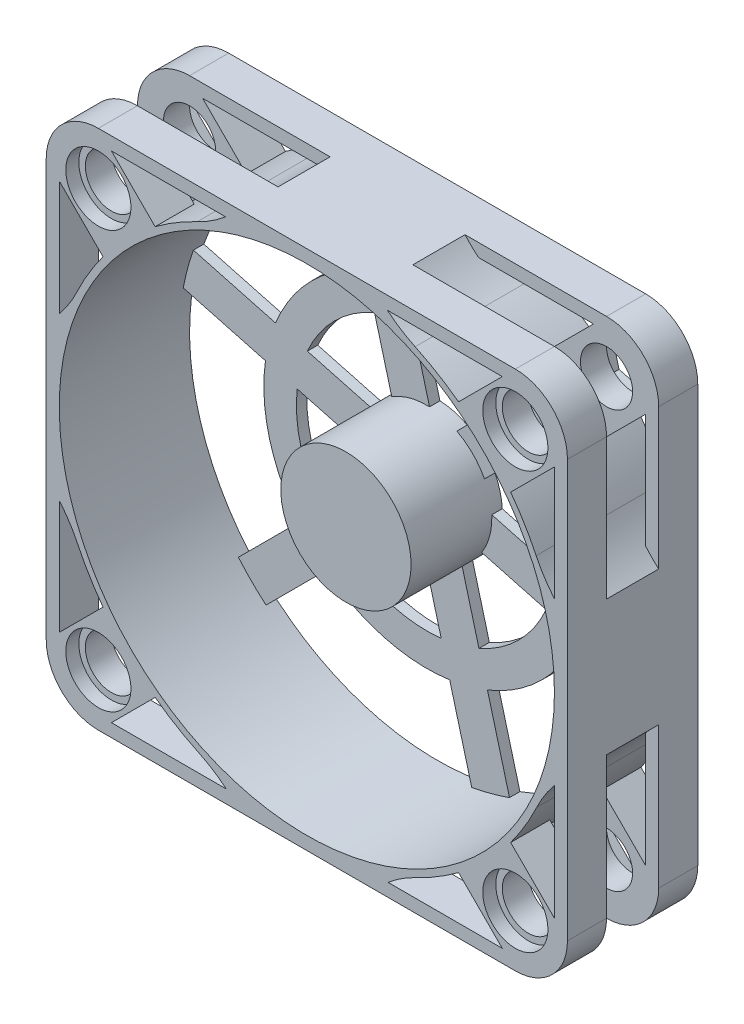
from build123d import *
from build123d.topology import SkipClean

# Parameters (mm, degrees)
ESQUISSE1_R                        = 2
ESQUISSE1_R_2                      = 19
ESQUISSE1_R_3                      = 5
BOSS_EXTRU_1_DEPTH                 = 10
ENL_V_START                        = -9.2
ESQUISSE2_R                        = 19
ESQUISSE2_R_2                      = 5
ENL_V_MAT_EXTRU_1_DEPTH            = 9.2
ENL_V_MAT_EXTRU_2_DEPTH            = 3
ESQUISSE4_R                        = 2.5
ENL_V_MAT_EXTRU_3_DEPTH            = 1
R_P_TITION_CIRCULAIRE1_COUNT       = 4
ENL_V_START_2                      = -3
ESQUISSE5_R                        = 5
ENL_V_MAT_EXTRU_4_DEPTH            = 3
SYM_TRIE1_COPY_1_DEPTH             = 3
SYM_TRIE1_COPY_2_DEPTH             = 3
SYM_TRIE1_COPY_3_DEPTH             = 3
SYM_TRIE1_COPY_4_SKETCH_R          = 2.5
SYM_TRIE1_COPY_4_DEPTH             = 1
SYM_TRIE1_COPY_5_SKETCH_R          = 2.5
SYM_TRIE1_COPY_5_DEPTH             = 1
SYM_TRIE1_COPY_6_SKETCH_R          = 2.5
SYM_TRIE1_COPY_6_DEPTH             = 1
ENL_V_MAT_EXTRU_5_REACH            = 57.815
ENL_V_MAT_EXTRU_5_END_RADIUS       = 19.5
ESQUISSE6_W                        = 20.966681846
ESQUISSE6_H                        = 4
CONG_2_R                           = 10
ENL_V_MAT_EXTRU_6_DEPTH            = 1
R_P_TITION_CIRCULAIRE3_COUNT       = 4
CONG_2_OF_R_P_TITION_CIRCULAIRE3_R = 10


with BuildPart() as part:
    # Esquisse1 → Boss.-Extru.1 (new body)
    # profile 1 of 26: a face of its own
    with BuildSketch(Plane.XY):
        with BuildLine():
            Line((16, 20), (-16, 20))
            ThreePointArc((-16, 20), (-18.828427125, 18.828427125), (-20, 16))
            Line((-20, 16), (-20, -16))
            ThreePointArc((-20, -16), (-18.828427125, -18.828427125), (-16, -20))
            Line((-16, -20), (16, -20))
            ThreePointArc((16, -20), (18.828427125, -18.828427125), (20, -16))
            Line((20, -16), (20, 16))
            ThreePointArc((20, 16), (18.828427125, 18.828427125), (16, 20))
        make_face()
        with Locations((-16, -16)):
            Circle(ESQUISSE1_R, mode=Mode.SUBTRACT)
        with Locations((16, -16)):
            Circle(ESQUISSE1_R, mode=Mode.SUBTRACT)
        with Locations((16, 16)):
            Circle(ESQUISSE1_R, mode=Mode.SUBTRACT)
        with Locations((-16, 16)):
            Circle(ESQUISSE1_R, mode=Mode.SUBTRACT)
        Circle(ESQUISSE1_R_2, mode=Mode.SUBTRACT)
    # profile 2 of 26: a face of its own
    with BuildSketch(Plane.XY):
        with BuildLine():
            Line((-12.332435064, -14.453755408), (-7.714304216, -9.835624559))
            ThreePointArc((-7.714304216, -9.835624559), (-8.838834765, -8.838834765), (-9.835624559, -7.714304216))
            Line((-9.835624559, -7.714304216), (-14.453755408, -12.332435064))
            ThreePointArc((-14.453755408, -12.332435064), (-13.435028843, -13.435028843), (-12.332435064, -14.453755408))
        make_face()
    # profile 3 of 26: a face of its own
    with BuildSketch(Plane.XY):
        with BuildLine():
            ThreePointArc((-8.051725899, -5.930405555), (-9.659258263, -2.588190451), (-9.93820195, 1.110018916))
            Line((-9.93820195, 1.110018916), (-12.375052838, 1.762971144))
            ThreePointArc((-12.375052838, 1.762971144), (-12.074072829, -3.235238064), (-9.835624559, -7.714304216))
            Line((-9.835624559, -7.714304216), (-8.051725899, -5.930405555))
        make_face()
    # profile 4 of 26: a face of its own
    with BuildSketch(Plane.XY):
        with BuildLine():
            Line((-7.714304216, -9.835624559), (-5.930405555, -8.051725899))
            ThreePointArc((-5.930405555, -8.051725899), (-7.071067812, -7.071067812), (-8.051725899, -5.930405555))
            Line((-8.051725899, -5.930405555), (-9.835624559, -7.714304216))
            ThreePointArc((-9.835624559, -7.714304216), (-8.838834765, -8.838834765), (-7.714304216, -9.835624559))
        make_face()
    # profile 5 of 26: a face of its own
    with BuildSketch(Plane.XY):
        with BuildLine():
            ThreePointArc((-8.051725899, -5.930405555), (-7.071067812, -7.071067812), (-5.930405555, -8.051725899))
            Line((-5.930405555, -8.051725899), (-2.312024219, -4.433344563))
            ThreePointArc((-2.312024219, -4.433344563), (-3.535533906, -3.535533906), (-4.433344563, -2.312024219))
            Line((-4.433344563, -2.312024219), (-8.051725899, -5.930405555))
        make_face()
    # profile 6 of 26: a face of its own
    with BuildSketch(Plane.XY):
        with BuildLine():
            Line((1.762971144, -12.375052838), (1.110018916, -9.93820195))
            ThreePointArc((1.110018916, -9.93820195), (-2.588190451, -9.659258263), (-5.930405555, -8.051725899))
            Line((-5.930405555, -8.051725899), (-7.714304216, -9.835624559))
            ThreePointArc((-7.714304216, -9.835624559), (-3.235238064, -12.074072829), (1.762971144, -12.375052838))
        make_face()
    # profile 7 of 26: a face of its own
    with BuildSketch(Plane.XY):
        with BuildLine():
            Line((4.660748623, -11.598595703), (4.007796395, -9.161744815))
            ThreePointArc((4.007796395, -9.161744815), (2.588190451, -9.659258263), (1.110018916, -9.93820195))
            Line((1.110018916, -9.93820195), (1.762971144, -12.375052838))
            ThreePointArc((1.762971144, -12.375052838), (3.235238064, -12.074072829), (4.660748623, -11.598595703))
        make_face()
    # profile 8 of 26: a face of its own
    with BuildSketch(Plane.XY):
        with BuildLine():
            ThreePointArc((1.110018916, -9.93820195), (2.588190451, -9.659258263), (4.007796395, -9.161744815))
            Line((4.007796395, -9.161744815), (2.683376905, -4.218943989))
            ThreePointArc((2.683376905, -4.218943989), (1.294095226, -4.829629131), (-0.214400573, -4.995401124))
            Line((-0.214400573, -4.995401124), (1.110018916, -9.93820195))
        make_face()
    # profile 9 of 26: a face of its own
    with BuildSketch(Plane.XY):
        with BuildLine():
            Line((6.351101831, -17.90707976), (4.660748623, -11.598595703))
            ThreePointArc((4.660748623, -11.598595703), (3.235238064, -12.074072829), (1.762971144, -12.375052838))
            Line((1.762971144, -12.375052838), (3.453324352, -18.683536895))
            ThreePointArc((3.453324352, -18.683536895), (4.917561857, -18.352590699), (6.351101831, -17.90707976))
        make_face()
    # profile 10 of 26: a face of its own
    with BuildSketch(Plane.XY):
        Circle(ESQUISSE1_R_3)
    # profile 11 of 26: a face of its own
    with BuildSketch(Plane.XY):
        with BuildLine():
            ThreePointArc((-12.375052838, 1.762971144), (-12.074072829, 3.235238064), (-11.598595703, 4.660748623))
            Line((-11.598595703, 4.660748623), (-17.90707976, 6.351101831))
            ThreePointArc((-17.90707976, 6.351101831), (-18.352590699, 4.917561857), (-18.683536895, 3.453324352))
            Line((-18.683536895, 3.453324352), (-12.375052838, 1.762971144))
        make_face()
    # profile 12 of 26: a face of its own
    with BuildSketch(Plane.XY):
        with BuildLine():
            ThreePointArc((-9.93820195, 1.110018916), (-9.659258263, 2.588190451), (-9.161744815, 4.007796395))
            Line((-9.161744815, 4.007796395), (-11.598595703, 4.660748623))
            ThreePointArc((-11.598595703, 4.660748623), (-12.074072829, 3.235238064), (-12.375052838, 1.762971144))
            Line((-12.375052838, 1.762971144), (-9.93820195, 1.110018916))
        make_face()
    # profile 13 of 26: a face of its own
    with BuildSketch(Plane.XY):
        with BuildLine():
            ThreePointArc((-4.995401124, -0.214400573), (-4.829629131, 1.294095226), (-4.218943989, 2.683376905))
            Line((-4.218943989, 2.683376905), (-9.161744815, 4.007796395))
            ThreePointArc((-9.161744815, 4.007796395), (-9.659258263, 2.588190451), (-9.93820195, 1.110018916))
            Line((-9.93820195, 1.110018916), (-4.995401124, -0.214400573))
        make_face()
    # profile 14 of 26: a face of its own
    with BuildSketch(Plane.XY):
        with BuildLine():
            ThreePointArc((-9.161744815, 4.007796395), (-7.071067812, 7.071067812), (-4.007796395, 9.161744815))
            Line((-4.007796395, 9.161744815), (-4.660748623, 11.598595703))
            ThreePointArc((-4.660748623, 11.598595703), (-8.838834765, 8.838834765), (-11.598595703, 4.660748623))
            Line((-11.598595703, 4.660748623), (-9.161744815, 4.007796395))
        make_face()
    # profile 15 of 26: a face of its own
    with BuildSketch(Plane.XY):
        with BuildLine():
            ThreePointArc((-4.660748623, 11.598595703), (-3.235238064, 12.074072829), (-1.762971144, 12.375052838))
            Line((-1.762971144, 12.375052838), (-3.453324352, 18.683536895))
            ThreePointArc((-3.453324352, 18.683536895), (-4.917561857, 18.352590699), (-6.351101831, 17.90707976))
            Line((-6.351101831, 17.90707976), (-4.660748623, 11.598595703))
        make_face()
    # profile 16 of 26: a face of its own
    with BuildSketch(Plane.XY):
        with BuildLine():
            ThreePointArc((-4.007796395, 9.161744815), (-2.588190451, 9.659258263), (-1.110018916, 9.93820195))
            Line((-1.110018916, 9.93820195), (-1.762971144, 12.375052838))
            ThreePointArc((-1.762971144, 12.375052838), (-3.235238064, 12.074072829), (-4.660748623, 11.598595703))
            Line((-4.660748623, 11.598595703), (-4.007796395, 9.161744815))
        make_face()
    # profile 17 of 26: a face of its own
    with BuildSketch(Plane.XY):
        with BuildLine():
            ThreePointArc((-2.683376905, 4.218943989), (-1.294095226, 4.829629131), (0.214400573, 4.995401124))
            Line((0.214400573, 4.995401124), (-1.110018916, 9.93820195))
            ThreePointArc((-1.110018916, 9.93820195), (-2.588190451, 9.659258263), (-4.007796395, 9.161744815))
            Line((-4.007796395, 9.161744815), (-2.683376905, 4.218943989))
        make_face()
    # profile 18 of 26: a face of its own
    with BuildSketch(Plane.XY):
        with BuildLine():
            ThreePointArc((-1.110018916, 9.93820195), (2.588190451, 9.659258263), (5.930405555, 8.051725899))
            Line((5.930405555, 8.051725899), (7.714304216, 9.835624559))
            ThreePointArc((7.714304216, 9.835624559), (3.235238064, 12.074072829), (-1.762971144, 12.375052838))
            Line((-1.762971144, 12.375052838), (-1.110018916, 9.93820195))
        make_face()
    # profile 19 of 26: a face of its own
    with BuildSketch(Plane.XY):
        with BuildLine():
            ThreePointArc((7.714304216, 9.835624559), (8.838834765, 8.838834765), (9.835624559, 7.714304216))
            Line((9.835624559, 7.714304216), (14.453755408, 12.332435064))
            ThreePointArc((14.453755408, 12.332435064), (13.435028843, 13.435028843), (12.332435064, 14.453755408))
            Line((12.332435064, 14.453755408), (7.714304216, 9.835624559))
        make_face()
    # profile 20 of 26: a face of its own
    with BuildSketch(Plane.XY):
        with BuildLine():
            ThreePointArc((2.312024219, 4.433344563), (3.535533906, 3.535533906), (4.433344563, 2.312024219))
            Line((4.433344563, 2.312024219), (8.051725899, 5.930405555))
            ThreePointArc((8.051725899, 5.930405555), (7.071067812, 7.071067812), (5.930405555, 8.051725899))
            Line((5.930405555, 8.051725899), (2.312024219, 4.433344563))
        make_face()
    # profile 21 of 26: a face of its own
    with BuildSketch(Plane.XY):
        with BuildLine():
            ThreePointArc((5.930405555, 8.051725899), (7.071067812, 7.071067812), (8.051725899, 5.930405555))
            Line((8.051725899, 5.930405555), (9.835624559, 7.714304216))
            ThreePointArc((9.835624559, 7.714304216), (8.838834765, 8.838834765), (7.714304216, 9.835624559))
            Line((7.714304216, 9.835624559), (5.930405555, 8.051725899))
        make_face()
    # profile 22 of 26: a face of its own
    with BuildSketch(Plane.XY):
        with BuildLine():
            Line((9.835624559, 7.714304216), (8.051725899, 5.930405555))
            ThreePointArc((8.051725899, 5.930405555), (9.500454173, 3.121116868), (10, 0))
            ThreePointArc((10, 0), (9.984538535, -0.555868913), (9.93820195, -1.110018916))
            Line((9.93820195, -1.110018916), (12.375052838, -1.762971144))
            ThreePointArc((12.375052838, -1.762971144), (12.468724082, -0.883696646), (12.5, 0))
            ThreePointArc((12.5, 0), (11.81514509, 4.080728673), (9.835624559, 7.714304216))
        make_face()
    # profile 23 of 26: a face of its own
    with BuildSketch(Plane.XY):
        with BuildLine():
            Line((12.375052838, -1.762971144), (9.93820195, -1.110018916))
            ThreePointArc((9.93820195, -1.110018916), (9.659258263, -2.588190451), (9.161744815, -4.007796395))
            Line((9.161744815, -4.007796395), (11.598595703, -4.660748623))
            ThreePointArc((11.598595703, -4.660748623), (12.074072829, -3.235238064), (12.375052838, -1.762971144))
        make_face()
    # profile 24 of 26: a face of its own
    with BuildSketch(Plane.XY):
        with BuildLine():
            Line((18.683536895, -3.453324352), (12.375052838, -1.762971144))
            ThreePointArc((12.375052838, -1.762971144), (12.074072829, -3.235238064), (11.598595703, -4.660748623))
            Line((11.598595703, -4.660748623), (17.90707976, -6.351101831))
            ThreePointArc((17.90707976, -6.351101831), (18.352590699, -4.917561857), (18.683536895, -3.453324352))
        make_face()
    # profile 25 of 26: a face of its own
    with BuildSketch(Plane.XY):
        with BuildLine():
            Line((11.598595703, -4.660748623), (9.161744815, -4.007796395))
            ThreePointArc((9.161744815, -4.007796395), (7.071067812, -7.071067812), (4.007796395, -9.161744815))
            Line((4.007796395, -9.161744815), (4.660748623, -11.598595703))
            ThreePointArc((4.660748623, -11.598595703), (8.838834765, -8.838834765), (11.598595703, -4.660748623))
        make_face()
    # profile 26 of 26: a face of its own
    with BuildSketch(Plane.XY):
        with BuildLine():
            Line((9.93820195, -1.110018916), (4.995401124, 0.214400573))
            ThreePointArc((4.995401124, 0.214400573), (4.998850149, 0.107224945), (5, 0))
            ThreePointArc((5, 0), (4.800766603, -1.397368966), (4.218943989, -2.683376905))
            Line((4.218943989, -2.683376905), (9.161744815, -4.007796395))
            ThreePointArc((9.161744815, -4.007796395), (9.659258263, -2.588190451), (9.93820195, -1.110018916))
        make_face()
    extrude(amount=BOSS_EXTRU_1_DEPTH)

    # Esquisse2 → Enlèv. mat.-Extru.1 (cut)
    with BuildSketch(Plane.XY.offset(10).offset(ENL_V_START)):
        with Locations(Location((0, 0, 0), (0, 0, 169.528063014))):
            Circle(ESQUISSE2_R)
        with Locations(Location((0, 0, 0), (0, 0, 182.457603124))):
            Circle(ESQUISSE2_R_2, mode=Mode.SUBTRACT)
    extrude(amount=ENL_V_MAT_EXTRU_1_DEPTH, mode=Mode.SUBTRACT)

    # Esquisse3 → Enlèv. mat.-Extru.2 (cut)
    with BuildSketch(Plane.XY.offset(10)):
        with BuildLine():
            Line((19, 4.387482194), (19, 15))
            Line((19, 15), (15.64276365, 11.64276365))
            ThreePointArc((15.64276365, 11.64276365), (17.697176203, 8.189014252), (19, 4.387482194))
        make_face()
        with BuildLine():
            Line((11.64276365, 15.64276365), (15, 19))
            Line((15, 19), (4.387482194, 19))
            ThreePointArc((4.387482194, 19), (8.189014252, 17.697176203), (11.64276365, 15.64276365))
        make_face()
    enl_v_mat_extru_2 = extrude(amount=-ENL_V_MAT_EXTRU_2_DEPTH, mode=Mode.SUBTRACT)

    # Esquisse4 → Enlèv. mat.-Extru.3 (cut)
    with BuildSketch(Plane.XY.offset(10)):
        with Locations((16, 16)):
            Circle(ESQUISSE4_R)
    enl_v_mat_extru_3 = extrude(amount=-ENL_V_MAT_EXTRU_3_DEPTH, mode=Mode.SUBTRACT)

    # Répétition circulaire1: Enlèv. mat.-Extru.2, Enlèv. mat.-Extru.3 ×4 about axis
    r_p_tition_circulaire1_axis = Axis((0, 0, 0), (0, 0, 1))
    add([enl_v_mat_extru_2.rotate(r_p_tition_circulaire1_axis, i * 360 / R_P_TITION_CIRCULAIRE1_COUNT) for i in range(1, R_P_TITION_CIRCULAIRE1_COUNT)], mode=Mode.SUBTRACT)
    add([enl_v_mat_extru_3.rotate(r_p_tition_circulaire1_axis, i * 360 / R_P_TITION_CIRCULAIRE1_COUNT) for i in range(1, R_P_TITION_CIRCULAIRE1_COUNT)], mode=Mode.SUBTRACT)

    # Esquisse5 → Enlèv. mat.-Extru.4 (cut)
    with BuildSketch(Plane.XY.offset(10).offset(ENL_V_START_2)):
        with Locations(Location((0, 0, 0), (0, 0, 182.457603124))):
            Circle(ESQUISSE5_R)
    extrude(amount=ENL_V_MAT_EXTRU_4_DEPTH, mode=Mode.SUBTRACT)

    # Symétrie1: Enlèv. mat.-Extru.2, Enlèv. mat.-Extru.3 across plane
    add(enl_v_mat_extru_2.mirror(Plane.XY.offset(5)), mode=Mode.SUBTRACT)
    add(enl_v_mat_extru_3.mirror(Plane.XY.offset(5)), mode=Mode.SUBTRACT)

    # Symétrie1 copy 1 sketch → Symétrie1 copy 1 (cut)
    with BuildSketch(Plane.YX):
        with BuildLine():
            Line((19, -4.387482194), (19, -15))
            Line((19, -15), (15.64276365, -11.64276365))
            ThreePointArc((15.64276365, -11.64276365), (17.697176203, -8.189014252), (19, -4.387482194))
        make_face()
        with BuildLine():
            Line((11.64276365, -15.64276365), (15, -19))
            Line((15, -19), (4.387482194, -19))
            ThreePointArc((4.387482194, -19), (8.189014252, -17.697176203), (11.64276365, -15.64276365))
        make_face()
    extrude(amount=-SYM_TRIE1_COPY_1_DEPTH, mode=Mode.SUBTRACT)

    # Symétrie1 copy 2 sketch → Symétrie1 copy 2 (cut)
    with BuildSketch(Plane(origin=(0, 0, 0), x_dir=(-1, 0, 0), z_dir=(0, 0, -1))):
        with BuildLine():
            Line((19, -4.387482194), (19, -15))
            Line((19, -15), (15.64276365, -11.64276365))
            ThreePointArc((15.64276365, -11.64276365), (17.697176203, -8.189014252), (19, -4.387482194))
        make_face()
        with BuildLine():
            Line((11.64276365, -15.64276365), (15, -19))
            Line((15, -19), (4.387482194, -19))
            ThreePointArc((4.387482194, -19), (8.189014252, -17.697176203), (11.64276365, -15.64276365))
        make_face()
    extrude(amount=-SYM_TRIE1_COPY_2_DEPTH, mode=Mode.SUBTRACT)

    # Symétrie1 copy 3 sketch → Symétrie1 copy 3 (cut)
    with BuildSketch(Plane(origin=(0, 0, 0), x_dir=(0, -1, 0), z_dir=(0, 0, -1))):
        with BuildLine():
            Line((19, -4.387482194), (19, -15))
            Line((19, -15), (15.64276365, -11.64276365))
            ThreePointArc((15.64276365, -11.64276365), (17.697176203, -8.189014252), (19, -4.387482194))
        make_face()
        with BuildLine():
            Line((11.64276365, -15.64276365), (15, -19))
            Line((15, -19), (4.387482194, -19))
            ThreePointArc((4.387482194, -19), (8.189014252, -17.697176203), (11.64276365, -15.64276365))
        make_face()
    extrude(amount=-SYM_TRIE1_COPY_3_DEPTH, mode=Mode.SUBTRACT)

    # Symétrie1 copy 4 sketch → Symétrie1 copy 4 (cut)
    with BuildSketch(Plane.YX):
        with Locations((16, -16)):
            Circle(SYM_TRIE1_COPY_4_SKETCH_R)
    extrude(amount=-SYM_TRIE1_COPY_4_DEPTH, mode=Mode.SUBTRACT)

    # Symétrie1 copy 5 sketch → Symétrie1 copy 5 (cut)
    with BuildSketch(Plane(origin=(0, 0, 0), x_dir=(-1, 0, 0), z_dir=(0, 0, -1))):
        with Locations((16, -16)):
            Circle(SYM_TRIE1_COPY_5_SKETCH_R)
    extrude(amount=-SYM_TRIE1_COPY_5_DEPTH, mode=Mode.SUBTRACT)

    # Symétrie1 copy 6 sketch → Symétrie1 copy 6 (cut)
    with BuildSketch(Plane(origin=(0, 0, 0), x_dir=(0, -1, 0), z_dir=(0, 0, -1))):
        with Locations((16, -16)):
            Circle(SYM_TRIE1_COPY_6_SKETCH_R)
    extrude(amount=-SYM_TRIE1_COPY_6_DEPTH, mode=Mode.SUBTRACT)

    # Enlèv. mat.-Extru.5: up to this cylinder (the profile starts outside it)
    with SkipClean():  # the faces are left unmerged after this step: merging them gives an invalid solid
        enl_v_mat_extru_5_end = Plane(origin=(0, 0, 5), z_dir=(0, 0, 1)) * Cylinder(ENL_V_MAT_EXTRU_5_END_RADIUS, 155.63, mode=Mode.PRIVATE)
        # Esquisse6 → Enlèv. mat.-Extru.5 (cut, up to the surface)
        with BuildSketch(Plane(origin=(18.828427125, 18.828427125, 0), x_dir=(0.7071067811865465, -0.7071067811865487, 0), z_dir=(0.7071067811865487, 0.7071067811865465, 0)), mode=Mode.PRIVATE) as enl_v_mat_extru_5_sk1:
            with Locations((-0.026783461, -5)):
                Rectangle(ESQUISSE6_W, ESQUISSE6_H)
        enl_v_mat_extru_5_tool1 = extrude(enl_v_mat_extru_5_sk1.sketch, amount=-ENL_V_MAT_EXTRU_5_REACH, mode=Mode.PRIVATE) - enl_v_mat_extru_5_end
        enl_v_mat_extru_5 = enl_v_mat_extru_5_tool1.solids().sort_by_distance((18.809488, 18.847366, 5))[0]
        add(enl_v_mat_extru_5, mode=Mode.SUBTRACT)

    # Congé2
    # the kernel refuses this fillet: 10 mm, written as the material it adds along each edge
    with BuildSketch(Plane(origin=(4.182592024, 19.046152471, -7.900502874), x_dir=(0.7071067811865485, 0.7071067811865466, 0), z_dir=(0, 0, 1))) as cong_2_piece_1_section:
        with BuildLine():
            CenterArc((11.33494574, -0.528934288), CONG_2_R, 176.968014873, 22.808085693)
            Line((1.924725912, -3.912388558), (1.736521516, -3.980057643))
            ThreePointArc((1.736521516, -3.980057643), (0.892599014, -1.99051512), (-0.168463618, -0.107796148))
            Line((-0.168463618, -0.107796148), (0, 0.2))
            ThreePointArc((0, 0.2), (0.674472056, 0.2), (1.149224079, 0.010578686))
            Line((1.149224079, 0.010578686), (1.348944112, 0))
        make_face()
    cong_2_piece_1 = extrude(amount=25.801005748, mode=Mode.PRIVATE)
    cong_2_piece_1 = split(cong_2_piece_1, bisect_by=Plane(origin=(5.678335463, 18.852677109, 0), z_dir=(0, 0, 1)), keep=Keep.TOP, mode=Mode.PRIVATE)
    cong_2_piece_1 = split(cong_2_piece_1, bisect_by=Plane(origin=(5.678335463, 18.852677109, 10), z_dir=(0, 0, -1)), keep=Keep.TOP, mode=Mode.PRIVATE)
    add(cong_2_piece_1)
    with BuildSketch(Plane(origin=(19.032425062, 4.244619683, -7.981208952), x_dir=(0.7071067811865501, 0.7071067811865449, 0), z_dir=(0, 0, 1))) as cong_2_piece_2_section:
        with BuildLine():
            CenterArc((11.349602028, 0.612176168), CONG_2_R, 160.506018461, 23.003687105)
            Line((1.922836532, 3.949254573), (1.734301222, 4.015996141))
            ThreePointArc((1.734301222, 4.015996141), (0.893153357, 2.007864511), (-0.16881391, 0.107246743))
            Line((-0.16881391, 0.107246743), (0, -0.2))
            ThreePointArc((0, -0.2), (0.6841788, -0.2), (1.168732711, -0.012243523))
            Line((1.168732711, -0.012243523), (1.3683576, 0))
        make_face()
    cong_2_piece_2 = extrude(amount=25.962417905, mode=Mode.PRIVATE)
    cong_2_piece_2 = split(cong_2_piece_2, bisect_by=Plane(origin=(18.836675219, 5.749474293, 0), z_dir=(0, 0, 1)), keep=Keep.TOP, mode=Mode.PRIVATE)
    cong_2_piece_2 = split(cong_2_piece_2, bisect_by=Plane(origin=(18.836675219, 5.749474293, 10), z_dir=(0, 0, -1)), keep=Keep.TOP, mode=Mode.PRIVATE)
    add(cong_2_piece_2)

    # Esquisse7 → Enlèv. mat.-Extru.6 (cut)
    with BuildSketch(Plane(origin=(0, 0, 0), x_dir=(-1, 0, 0), z_dir=(0, 0, -1))):
        Polygon((18.041241452, 18.041241452), (15.252853773, 18.788387679), (13.211612321, 16.747146227), (13.958758548, 13.958758548), (16.747146227, 13.211612321), (18.788387679, 15.252853773), align=None)
    enl_v_mat_extru_6 = extrude(amount=-ENL_V_MAT_EXTRU_6_DEPTH, mode=Mode.SUBTRACT)

    # Répétition circulaire3: Enlèv. mat.-Extru.5, Enlèv. mat.-Extru.6 ×4 about axis
    r_p_tition_circulaire3_axis = Axis((0, 0, 0), (0, 0, 1))
    add([enl_v_mat_extru_5.rotate(r_p_tition_circulaire3_axis, i * 360 / R_P_TITION_CIRCULAIRE3_COUNT) for i in range(1, R_P_TITION_CIRCULAIRE3_COUNT)], mode=Mode.SUBTRACT)
    add([enl_v_mat_extru_6.rotate(r_p_tition_circulaire3_axis, i * 360 / R_P_TITION_CIRCULAIRE3_COUNT) for i in range(1, R_P_TITION_CIRCULAIRE3_COUNT)], mode=Mode.SUBTRACT)

    # Congé2 of Répétition circulaire3
    # the kernel refuses this fillet: 10 mm, written as the material it adds along each edge
    with BuildSketch(Plane(origin=(-19.046152471, 4.182592024, -7.900502874), x_dir=(0.3223451595781344, 0.946622204523297, 0), z_dir=(0, 0, 1))) as cong_2_of_r_p_tition_circulaire3_piece_1_section:
        with BuildLine():
            CenterArc((5.478201444, 9.937307248), CONG_2_OF_R_P_TITION_CIRCULAIRE3_R, 240.772824507, 22.808085693)
            Line((0.595465117, 1.210401384), (0.49781039, 1.035863267))
            ThreePointArc((0.49781039, 1.035863267), (0.118273473, 0.693486799), (-0.179459086, 0.088286106))
            Line((-0.179459086, 0.088286106), (0.022360006, -0.198746145))
            ThreePointArc((0.022360006, -0.198746145), (2.180100575, -0.077749134), (4.337841144, -0.198746145))
            Line((4.337841144, -0.198746145), (4.36020115, 0))
        make_face()
    cong_2_of_r_p_tition_circulaire3_piece_1 = extrude(amount=25.801005748, mode=Mode.PRIVATE)
    cong_2_of_r_p_tition_circulaire3_piece_1 = split(cong_2_of_r_p_tition_circulaire3_piece_1, bisect_by=Plane(origin=(-18.852677109, 5.678335463, 10), z_dir=(0, 0, -1)), keep=Keep.TOP, mode=Mode.PRIVATE)
    cong_2_of_r_p_tition_circulaire3_piece_1 = split(cong_2_of_r_p_tition_circulaire3_piece_1, bisect_by=Plane(origin=(-18.852677109, 5.678335463, 0), z_dir=(0, 0, 1)), keep=Keep.TOP, mode=Mode.PRIVATE)
    add(cong_2_of_r_p_tition_circulaire3_piece_1)
    with BuildSketch(Plane(origin=(-4.244619683, 19.032425062, -7.981208952), x_dir=(-0.7071067811865449, 0.7071067811865501, 0), z_dir=(0, 0, 1))) as cong_2_of_r_p_tition_circulaire3_piece_2_section:
        with BuildLine():
            CenterArc((11.349602028, 0.612176168), CONG_2_OF_R_P_TITION_CIRCULAIRE3_R, 160.506018461, 23.003687105)
            Line((1.922836532, 3.949254573), (1.734301222, 4.015996141))
            ThreePointArc((1.734301222, 4.015996141), (0.893153357, 2.007864511), (-0.16881391, 0.107246743))
            Line((-0.16881391, 0.107246743), (0, -0.2))
            ThreePointArc((0, -0.2), (0.6841788, -0.2), (1.168732711, -0.012243523))
            Line((1.168732711, -0.012243523), (1.3683576, 0))
        make_face()
    cong_2_of_r_p_tition_circulaire3_piece_2 = extrude(amount=25.962417905, mode=Mode.PRIVATE)
    cong_2_of_r_p_tition_circulaire3_piece_2 = split(cong_2_of_r_p_tition_circulaire3_piece_2, bisect_by=Plane(origin=(-5.749474293, 18.836675219, 10), z_dir=(0, 0, -1)), keep=Keep.TOP, mode=Mode.PRIVATE)
    cong_2_of_r_p_tition_circulaire3_piece_2 = split(cong_2_of_r_p_tition_circulaire3_piece_2, bisect_by=Plane(origin=(-5.749474293, 18.836675219, 0), z_dir=(0, 0, 1)), keep=Keep.TOP, mode=Mode.PRIVATE)
    add(cong_2_of_r_p_tition_circulaire3_piece_2)
    with BuildSketch(Plane(origin=(-4.182592024, -19.046152471, -7.900502874), x_dir=(-0.9466222045232972, 0.32234515957813453, 0), z_dir=(0, 0, 1))) as cong_2_of_r_p_tition_circulaire3_piece_3_section:
        with BuildLine():
            CenterArc((5.478201444, 9.937307248), CONG_2_OF_R_P_TITION_CIRCULAIRE3_R, 240.772824507, 22.808085693)
            Line((0.595465117, 1.210401384), (0.49781039, 1.035863267))
            ThreePointArc((0.49781039, 1.035863267), (0.118273473, 0.693486799), (-0.179459086, 0.088286106))
            Line((-0.179459086, 0.088286106), (0.022360006, -0.198746145))
            ThreePointArc((0.022360006, -0.198746145), (2.180100575, -0.077749134), (4.337841144, -0.198746145))
            Line((4.337841144, -0.198746145), (4.36020115, 0))
        make_face()
    cong_2_of_r_p_tition_circulaire3_piece_3 = extrude(amount=25.801005748, mode=Mode.PRIVATE)
    cong_2_of_r_p_tition_circulaire3_piece_3 = split(cong_2_of_r_p_tition_circulaire3_piece_3, bisect_by=Plane(origin=(-5.678335463, -18.852677109, 10), z_dir=(0, 0, -1)), keep=Keep.TOP, mode=Mode.PRIVATE)
    cong_2_of_r_p_tition_circulaire3_piece_3 = split(cong_2_of_r_p_tition_circulaire3_piece_3, bisect_by=Plane(origin=(-5.678335463, -18.852677109, 0), z_dir=(0, 0, 1)), keep=Keep.TOP, mode=Mode.PRIVATE)
    add(cong_2_of_r_p_tition_circulaire3_piece_3)
    with BuildSketch(Plane(origin=(-19.032425062, -4.244619683, -7.981208952), x_dir=(-0.7071067811865489, -0.7071067811865462, 0), z_dir=(0, 0, 1))) as cong_2_of_r_p_tition_circulaire3_piece_4_section:
        with BuildLine():
            CenterArc((11.349602028, 0.612176168), CONG_2_OF_R_P_TITION_CIRCULAIRE3_R, 160.506018461, 23.003687105)
            Line((1.922836532, 3.949254573), (1.734301222, 4.015996141))
            ThreePointArc((1.734301222, 4.015996141), (0.893153357, 2.007864511), (-0.16881391, 0.107246743))
            Line((-0.16881391, 0.107246743), (0, -0.2))
            ThreePointArc((0, -0.2), (0.6841788, -0.2), (1.168732711, -0.012243523))
            Line((1.168732711, -0.012243523), (1.3683576, 0))
        make_face()
    cong_2_of_r_p_tition_circulaire3_piece_4 = extrude(amount=25.962417905, mode=Mode.PRIVATE)
    cong_2_of_r_p_tition_circulaire3_piece_4 = split(cong_2_of_r_p_tition_circulaire3_piece_4, bisect_by=Plane(origin=(-18.836675219, -5.749474293, 10), z_dir=(0, 0, -1)), keep=Keep.TOP, mode=Mode.PRIVATE)
    cong_2_of_r_p_tition_circulaire3_piece_4 = split(cong_2_of_r_p_tition_circulaire3_piece_4, bisect_by=Plane(origin=(-18.836675219, -5.749474293, 0), z_dir=(0, 0, 1)), keep=Keep.TOP, mode=Mode.PRIVATE)
    add(cong_2_of_r_p_tition_circulaire3_piece_4)
    with BuildSketch(Plane(origin=(19.046152471, -4.182592024, -7.900502874), x_dir=(-0.32234515957813553, -0.9466222045232968, 0), z_dir=(0, 0, 1))) as cong_2_of_r_p_tition_circulaire3_piece_5_section:
        with BuildLine():
            CenterArc((5.478201444, 9.937307248), CONG_2_OF_R_P_TITION_CIRCULAIRE3_R, 240.772824507, 22.808085693)
            Line((0.595465117, 1.210401384), (0.49781039, 1.035863267))
            ThreePointArc((0.49781039, 1.035863267), (0.118273473, 0.693486799), (-0.179459086, 0.088286106))
            Line((-0.179459086, 0.088286106), (0.022360006, -0.198746145))
            ThreePointArc((0.022360006, -0.198746145), (2.180100575, -0.077749134), (4.337841144, -0.198746145))
            Line((4.337841144, -0.198746145), (4.36020115, 0))
        make_face()
    cong_2_of_r_p_tition_circulaire3_piece_5 = extrude(amount=25.801005748, mode=Mode.PRIVATE)
    cong_2_of_r_p_tition_circulaire3_piece_5 = split(cong_2_of_r_p_tition_circulaire3_piece_5, bisect_by=Plane(origin=(18.852677109, -5.678335463, 10), z_dir=(0, 0, -1)), keep=Keep.TOP, mode=Mode.PRIVATE)
    cong_2_of_r_p_tition_circulaire3_piece_5 = split(cong_2_of_r_p_tition_circulaire3_piece_5, bisect_by=Plane(origin=(18.852677109, -5.678335463, 0), z_dir=(0, 0, 1)), keep=Keep.TOP, mode=Mode.PRIVATE)
    add(cong_2_of_r_p_tition_circulaire3_piece_5)
    with BuildSketch(Plane(origin=(4.244619683, -19.032425062, -7.981208952), x_dir=(0.7071067811865458, -0.7071067811865491, 0), z_dir=(0, 0, 1))) as cong_2_of_r_p_tition_circulaire3_piece_6_section:
        with BuildLine():
            CenterArc((11.349602028, 0.612176168), CONG_2_OF_R_P_TITION_CIRCULAIRE3_R, 160.506018461, 23.003687105)
            Line((1.922836532, 3.949254573), (1.734301222, 4.015996141))
            ThreePointArc((1.734301222, 4.015996141), (0.893153357, 2.007864511), (-0.16881391, 0.107246743))
            Line((-0.16881391, 0.107246743), (0, -0.2))
            ThreePointArc((0, -0.2), (0.6841788, -0.2), (1.168732711, -0.012243523))
            Line((1.168732711, -0.012243523), (1.3683576, 0))
        make_face()
    cong_2_of_r_p_tition_circulaire3_piece_6 = extrude(amount=25.962417905, mode=Mode.PRIVATE)
    cong_2_of_r_p_tition_circulaire3_piece_6 = split(cong_2_of_r_p_tition_circulaire3_piece_6, bisect_by=Plane(origin=(5.749474293, -18.836675219, 10), z_dir=(0, 0, -1)), keep=Keep.TOP, mode=Mode.PRIVATE)
    cong_2_of_r_p_tition_circulaire3_piece_6 = split(cong_2_of_r_p_tition_circulaire3_piece_6, bisect_by=Plane(origin=(5.749474293, -18.836675219, 0), z_dir=(0, 0, 1)), keep=Keep.TOP, mode=Mode.PRIVATE)
    add(cong_2_of_r_p_tition_circulaire3_piece_6)


solid = part.part
